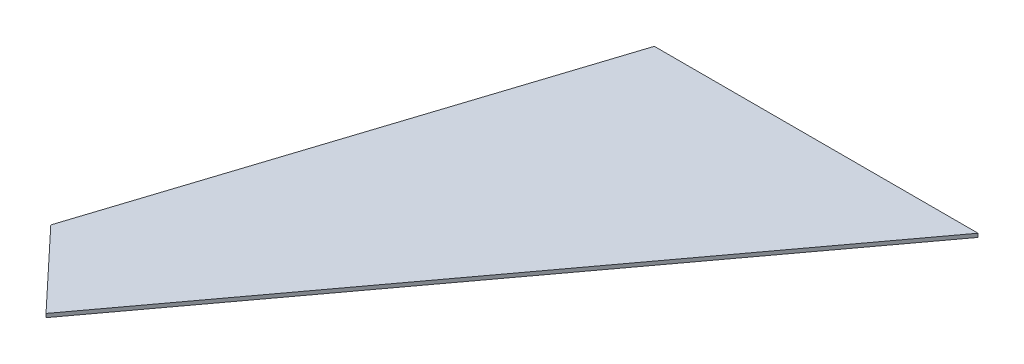
from build123d import *

# Parameters (mm, degrees)
SKETCH1_W           = 500
SKETCH1_H           = 500
BOSS_EXTRUDE1_DEPTH = 2.9972
SKETCH2_OUTSIDE_W   = 643.422
SKETCH2_OUTSIDE_H   = 643.422
CUT_EXTRUDE1_DEPTH  = 708.113133245


with BuildPart() as part:
    # Sketch1 → Boss-Extrude1 (new body)
    with BuildSketch(Plane(origin=(0, 0, 0), x_dir=(1, 0, 0), z_dir=(0, 1, 0))):
        with Locations((250, -250)):
            Rectangle(SKETCH1_W, SKETCH1_H)
    extrude(amount=BOSS_EXTRUDE1_DEPTH)

    # Sketch2 outside → Cut-Extrude1 (cut, through all)
    with BuildSketch(Plane.XZ):
        with Locations((250, 250)):
            Rectangle(SKETCH2_OUTSIDE_W, SKETCH2_OUTSIDE_H)
        Polygon((384.375074767, 0), (120.099439006, 0), (0, 372.689197492), (60.629407312, 437.226769752), align=None, mode=Mode.SUBTRACT)
    extrude(amount=-CUT_EXTRUDE1_DEPTH, mode=Mode.SUBTRACT)


solid = part.part
